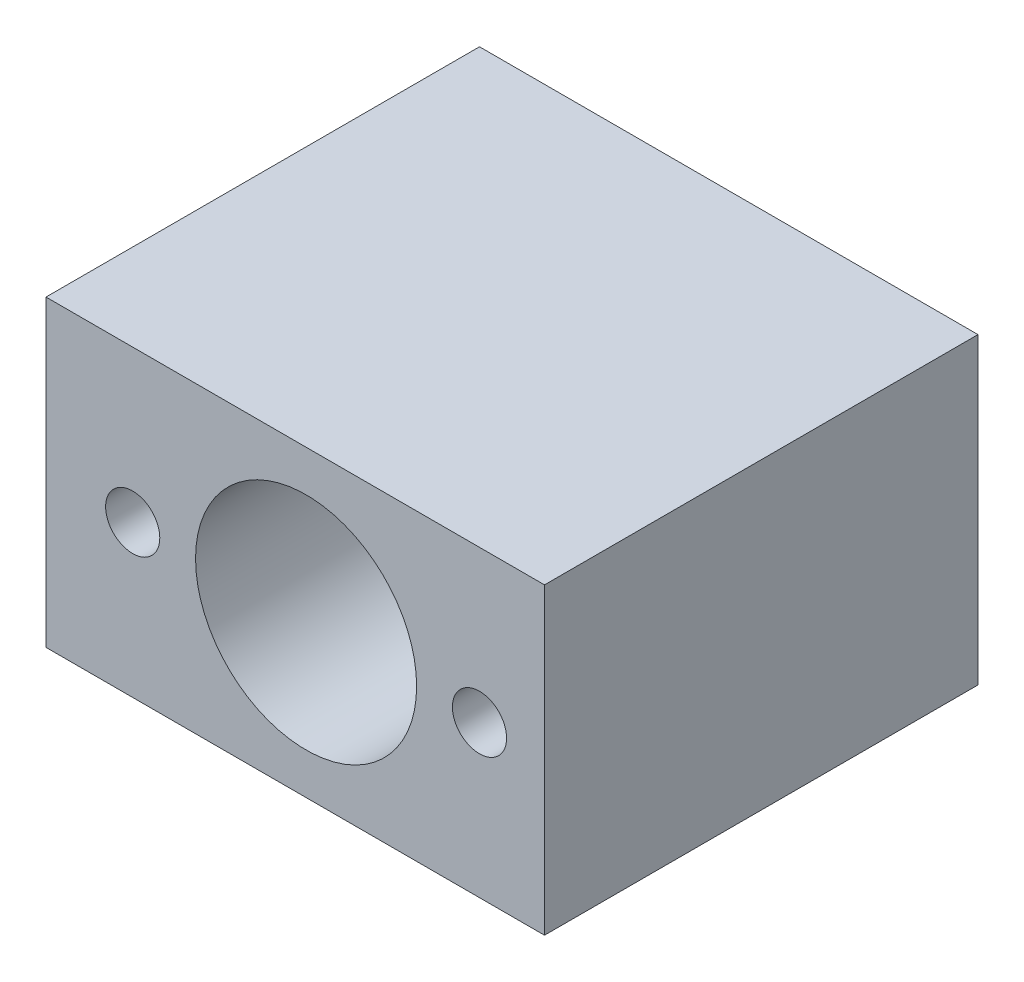
from build123d import *

# Parameters (mm, degrees)
CROQUIS1_W                                     = 23
CROQUIS1_H                                     = 14
CROQUIS1_R                                     = 5.1
SALIENTE_EXTRUIR1_DEPTH                        = 20
PERFORADOR_PARA_ROSCAR_PARA_MACHO_DE_ROS_D     = 2.5
PERFORADOR_PARA_ROSCAR_PARA_MACHO_DE_ROS_DEPTH = 12
PERFORADOR_PARA_ROSCAR_PARA_MACHO_DE_ROS_TIP   = 0.751075774


with BuildPart() as part:
    # Croquis1 → Saliente-Extruir1 (new body)
    with BuildSketch(Plane.XY):
        with Locations((11.5, 7)):
            Rectangle(CROQUIS1_W, CROQUIS1_H)
        with Locations((12, 7)):
            Circle(CROQUIS1_R, mode=Mode.SUBTRACT)
    extrude(amount=SALIENTE_EXTRUIR1_DEPTH)

    # Perforador para roscar para macho de roscar para M31
    with Locations(Plane.XY.offset(20)):
        with Locations((4, 7), (20, 7)):
            Hole(PERFORADOR_PARA_ROSCAR_PARA_MACHO_DE_ROS_D / 2, depth=PERFORADOR_PARA_ROSCAR_PARA_MACHO_DE_ROS_DEPTH)
            with Locations((0, 0, -(PERFORADOR_PARA_ROSCAR_PARA_MACHO_DE_ROS_DEPTH + PERFORADOR_PARA_ROSCAR_PARA_MACHO_DE_ROS_TIP / 2))):  # 118° drill point
                Cone(0, PERFORADOR_PARA_ROSCAR_PARA_MACHO_DE_ROS_D / 2, PERFORADOR_PARA_ROSCAR_PARA_MACHO_DE_ROS_TIP, mode=Mode.SUBTRACT)


solid = part.part
